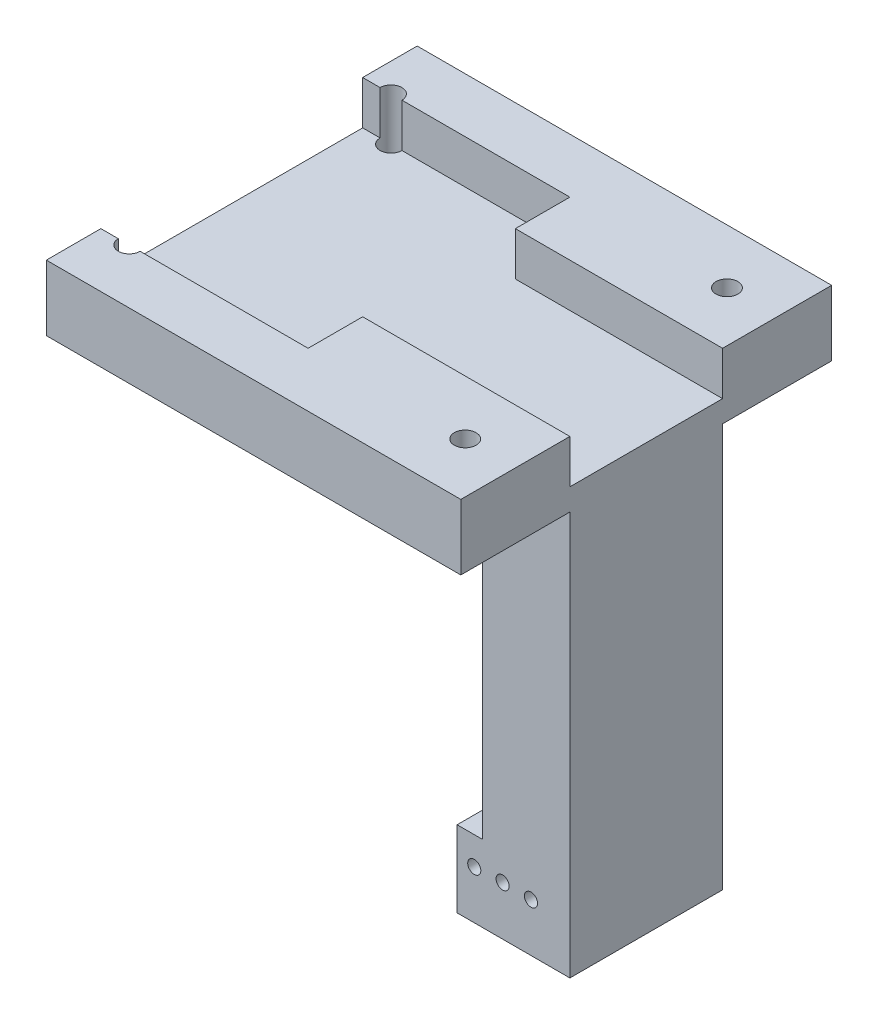
from build123d import *
from build123d.topology import SkipClean

# Parameters (mm, degrees)
SKETCH3_W                = 4.167944103
SKETCH3_H                = 2.5
SKETCH3_R                = 0.3
BOSS_EXTRUDE1_DEPTH      = 3
SKETCH6_W                = 3
SKETCH6_H                = 15
BOSS_EXTRUDE3_DEPTH      = 3
BOSS_EXTRUDE4_DEPTH      = 8
SKETCH7_R                = 0.5
CUT_EXTRUDE1_DEPTH       = 1
BOSS_EXTRUDE5_DEPTH      = 1
BOSS_EXTRUDE5_DEPTH_BACK = 1
BOSS_EXTRUDE6_DEPTH      = 3.5
BOSS_EXTRUDE6_DEPTH_BACK = 3.5
SKETCH8_5_W              = 4.167944103
SKETCH8_5_H              = 1
BOSS_EXTRUDE7_DEPTH      = 3.5
BOSS_EXTRUDE7_DEPTH_BACK = 3.5
BOSS_EXTRUDE8_START      = 2
SKETCH9_R                = 0.5
BOSS_EXTRUDE8_DEPTH      = 2
BOSS_EXTRUDE9_DEPTH      = 8.5
BOSS_EXTRUDE9_DEPTH_BACK = 8.5
SKETCH8_7_W              = 1
SKETCH8_7_H              = 1


with BuildPart() as part:
    # Sketch3 → Boss-Extrude1 (new body)
    with BuildSketch(Plane.XY):
        with Locations((0.002500359, -0.178234892)):
            Rectangle(SKETCH3_W, SKETCH3_H)
        with Locations((-1.297499642, -0.208485146)):
            Circle(SKETCH3_R, mode=Mode.SUBTRACT)
        with Locations((1.302500358, -0.208485146)):
            Circle(SKETCH3_R, mode=Mode.SUBTRACT)
        with Locations((0.002500358, -0.178234892)):
            Circle(SKETCH3_R, mode=Mode.SUBTRACT)
    extrude(amount=BOSS_EXTRUDE1_DEPTH)

    # Sketch6 → Boss-Extrude3 (add)
    with BuildSketch(Plane.XY):
        with Locations((0.58647241, 8.571765108)):
            Rectangle(SKETCH6_W, SKETCH6_H)
        Polygon((-0.91352759, 16.071765108), (2.08647241, 16.071765108), (2.08647241, 17.071765108), (-15.91352759, 17.071765108), (-15.91352759, 16.071765108), align=None)
    extrude(amount=BOSS_EXTRUDE3_DEPTH)

    # Sketch6<5> → Boss-Extrude4 (add)
    with BuildSketch(Plane.XY):
        Polygon((-0.91352759, 16.071765108), (2.08647241, 16.071765108), (2.08647241, 17.071765108), (-15.91352759, 17.071765108), (-15.91352759, 16.071765108), align=None)
    extrude(amount=BOSS_EXTRUDE4_DEPTH)


with BuildPart() as body_2:
    # Mirror4: mirrored copy
    add(part.part.mirror(Plane(origin=(0, 0, -0.5), x_dir=(1, 0, 0), z_dir=(0, 0, -1))))


with BuildPart() as cut_extrude1_tool:
    # Sketch7 → Cut-Extrude1 (new body)
    with BuildSketch(Plane(origin=(0, 17.071765108, 0), x_dir=(1, 0, 0), z_dir=(0, 1, 0))):
        with Locations((-14.61352759, -5.5)):
            Circle(SKETCH7_R)
        with Locations((-14.61352759, 6.5)):
            Circle(SKETCH7_R)
        with Locations((0.78647241, -5.5)):
            Circle(SKETCH7_R)
        with Locations((0.78647241, 6.5)):
            Circle(SKETCH7_R)
    extrude(amount=-CUT_EXTRUDE1_DEPTH)


with BuildPart() as part_1:
    add(part.part)

    # Cut-Extrude1: cut by cut_extrude1_tool
    add(cut_extrude1_tool.part, mode=Mode.SUBTRACT)



with BuildPart() as body_2_1:
    add(body_2.part)

    # Cut-Extrude1: cut by cut_extrude1_tool
    add(cut_extrude1_tool.part, mode=Mode.SUBTRACT)


with BuildPart() as part_2:
    add(part_1.part)

    add(body_2_1.part)  # Boss-Extrude5 merges body 2
    # Sketch8 → Boss-Extrude5 (add, two sides: drawn at the far end of the back side and taken through both)
    with BuildSketch(Plane(origin=(0, 0, -0.5), x_dir=(-1, 0, 0), z_dir=(0, 0, -1)).offset(-BOSS_EXTRUDE5_DEPTH_BACK)):
        Polygon((2.081471693, -2.428234892), (2.081471693, -1.428234892), (-2.08647241, -1.428234892), (-2.08647241, 1.071765108), (0.91352759, 1.071765108), (0.91352759, 16.071765108), (15.91352759, 16.071765108), (15.91352759, 17.071765108), (-3.08647241, 17.071765108), (-3.08647241, -2.428234892), align=None)
    extrude(amount=BOSS_EXTRUDE5_DEPTH + BOSS_EXTRUDE5_DEPTH_BACK)

    # Sketch8<5> → Boss-Extrude6 (add, two sides: drawn at the far end of the back side and taken through both)
    with BuildSketch(Plane(origin=(0, 0, -0.5), x_dir=(-1, 0, 0), z_dir=(0, 0, -1)).offset(-BOSS_EXTRUDE6_DEPTH_BACK)):
        with Locations((-0.002500359, -1.928234892)):
            Rectangle(SKETCH8_5_W, SKETCH8_5_H)
    extrude(amount=BOSS_EXTRUDE6_DEPTH + BOSS_EXTRUDE6_DEPTH_BACK)

    # Sketch8<6> → Boss-Extrude7 (add, two sides: drawn at the far end of the back side and taken through both)
    with BuildSketch(Plane(origin=(0, 0, -0.5), x_dir=(-1, 0, 0), z_dir=(0, 0, -1)).offset(-BOSS_EXTRUDE7_DEPTH_BACK)):
        Polygon((-2.08647241, -2.428234892), (-2.08647241, -1.428234892), (-2.08647241, 1.071765108), (-2.08647241, 16.071765108), (-3.08647241, 16.071765108), (-3.08647241, -2.428234892), align=None)
    extrude(amount=BOSS_EXTRUDE7_DEPTH + BOSS_EXTRUDE7_DEPTH_BACK)

    # Sketch9 → Boss-Extrude8 (add)
    # profile 1 of 2: a face of its own
    with SkipClean():  # the faces are left unmerged after this step: merging them gives an invalid solid
        with BuildSketch(Plane(origin=(0, 17.071765108, 0), x_dir=(1, 0, 0), z_dir=(0, 1, 0)).offset(BOSS_EXTRUDE8_START)):
            with BuildLine():
                Line((-15.11352759, -5.5), (-15.91352759, -5.5))
                Line((-15.91352759, -5.5), (-15.91352759, -8))
                Line((-15.91352759, -8), (3.08647241, -8))
                Line((3.08647241, -8), (3.08647241, -3))
                Line((3.08647241, -3), (-6.41352759, -3))
                Line((-6.41352759, -3), (-6.41352759, -5.5))
                Line((-6.41352759, -5.5), (-14.11352759, -5.5))
                ThreePointArc((-14.11352759, -5.5), (-14.61352759, -6), (-15.11352759, -5.5))
            make_face()
            with Locations((0.78647241, -5.5)):
                Circle(SKETCH9_R, mode=Mode.SUBTRACT)
        # profile 2 of 2: a face of its own
        with BuildSketch(Plane(origin=(0, 17.071765108, 0), x_dir=(1, 0, 0), z_dir=(0, 1, 0)).offset(BOSS_EXTRUDE8_START)):
            with BuildLine():
                Line((-6.41352759, 6.5), (-6.41352759, 4))
                Line((-6.41352759, 4), (3.08647241, 4))
                Line((3.08647241, 4), (3.08647241, 9))
                Line((3.08647241, 9), (-15.91352759, 9))
                Line((-15.91352759, 9), (-15.91352759, 6.5))
                Line((-15.91352759, 6.5), (-15.11352759, 6.5))
                ThreePointArc((-15.11352759, 6.5), (-14.61352759, 7), (-14.11352759, 6.5))
                Line((-14.11352759, 6.5), (-6.41352759, 6.5))
            make_face()
            with Locations((0.78647241, 6.5)):
                Circle(SKETCH9_R, mode=Mode.SUBTRACT)
        extrude(amount=-BOSS_EXTRUDE8_DEPTH)

    # Sketch8<7> → Boss-Extrude9 (add, two sides: drawn at the far end of the back side and taken through both)
    with SkipClean():  # the faces are left unmerged after this step: merging them gives an invalid solid
        with BuildSketch(Plane(origin=(0, 0, -0.5), x_dir=(-1, 0, 0), z_dir=(0, 0, -1)).offset(-BOSS_EXTRUDE9_DEPTH_BACK)):
            with Locations((-2.58647241, 16.571765108)):
                Rectangle(SKETCH8_7_W, SKETCH8_7_H)
        extrude(amount=BOSS_EXTRUDE9_DEPTH + BOSS_EXTRUDE9_DEPTH_BACK)


solid = part_2.part
